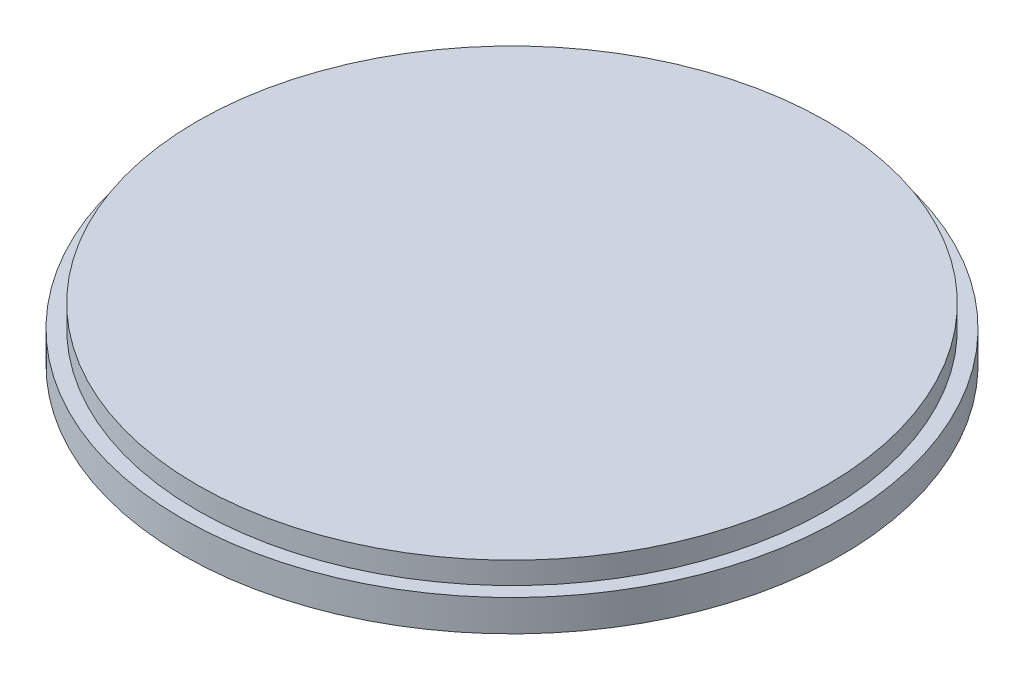
from build123d import *

# Parameters (mm, degrees)
SKETCH2_R                = 43
BOSS_EXTRUDE1_DEPTH      = 3
M3_CLEARANCE_HOLE1_D     = 3.4
M3_CLEARANCE_HOLE1_DEPTH = 4
M3_CLEARANCE_HOLE1_TIP   = 1.021463052


with BuildPart() as part:
    # Sketch1 → Revolve1 (revolve)
    with BuildSketch(Plane.XY):
        Polygon((-26.5, -7), (-45, -4.3), (-45, 0), (0, 0), (0, -7), align=None)
    revolve(axis=Axis((0, -7, 0), (0, 1, 0)))

    # Sketch2 → Boss-Extrude1 (add)
    with BuildSketch(Plane(origin=(0, 0, 0), x_dir=(1, 0, 0), z_dir=(0, 1, 0))):
        Circle(SKETCH2_R)
    extrude(amount=BOSS_EXTRUDE1_DEPTH)

    # M3 Clearance Hole1
    with Locations(Plane(origin=(0, -7, 0), x_dir=(-1, 0, 0), z_dir=(0, -1, 0))):
        with Locations((15.556349186, -15.556349186), (15.556349186, 15.556349186), (-15.556349186, 15.556349186), (-15.556349186, -15.556349186)):
            Hole(M3_CLEARANCE_HOLE1_D / 2, depth=M3_CLEARANCE_HOLE1_DEPTH)
            with Locations((0, 0, -(M3_CLEARANCE_HOLE1_DEPTH + M3_CLEARANCE_HOLE1_TIP / 2))):  # 118° drill point
                Cone(0, M3_CLEARANCE_HOLE1_D / 2, M3_CLEARANCE_HOLE1_TIP, mode=Mode.SUBTRACT)


solid = part.part
